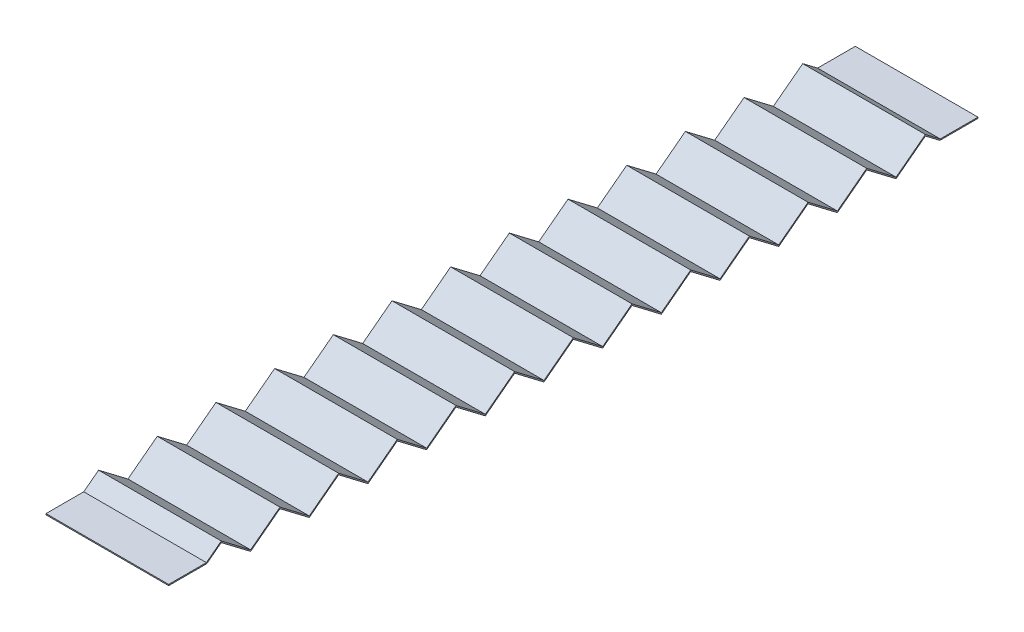
from build123d import *

# Parameters (mm, degrees)
EXTRUDE_THIN1_DEPTH = 27.5


with BuildPart() as part:
    # Sketch3 → Extrude-Thin1 (new, symmetric)
    with BuildSketch(Plane(origin=(0, 0, 0), x_dir=(0, 0, -1), z_dir=(1, 0, 0))):
        Polygon((0, 4.75), (17.084244345, 4.75), (23.576452135, 9.685950005), (36.729356406, -0.314049995), (49.882260677, 9.685950005), (63.035164948, -0.314049995), (76.188069219, 9.685950005), (89.34097349, -0.314049995), (102.493877761, 9.685950005), (115.646782031, -0.314049995), (128.799686302, 9.685950005), (141.952590573, -0.314049995), (155.105494844, 9.685950005), (168.258399115, -0.314049995), (181.411303386, 9.685950005), (194.564207657, -0.314049995), (207.717111927, 9.685950005), (220.870016198, -0.314049995), (234.022920469, 9.685950005), (247.17582474, -0.314049995), (260.328729011, 9.685950005), (273.481633282, -0.314049995), (286.634537553, 9.685950005), (299.787441823, -0.314049995), (312.940346094, 9.685950005), (326.093250365, -0.314049995), (339.246154636, 9.685950005), (345.738362426, 4.75), (362.822606771, 4.75), (362.822606771, 5.25), (345.906851117, 5.25), (339.246154636, 10.314049995), (326.093250365, 0.314049995), (312.940346094, 10.314049995), (299.787441823, 0.314049995), (286.634537553, 10.314049995), (273.481633282, 0.314049995), (260.328729011, 10.314049995), (247.17582474, 0.314049995), (234.022920469, 10.314049995), (220.870016198, 0.314049995), (207.717111927, 10.314049995), (194.564207657, 0.314049995), (181.411303386, 10.314049995), (168.258399115, 0.314049995), (155.105494844, 10.314049995), (141.952590573, 0.314049995), (128.799686302, 10.314049995), (115.646782031, 0.314049995), (102.493877761, 10.314049995), (89.34097349, 0.314049995), (76.188069219, 10.314049995), (63.035164948, 0.314049995), (49.882260677, 10.314049995), (36.729356406, 0.314049995), (23.576452135, 10.314049995), (16.915755655, 5.25), (0, 5.25), align=None)
    extrude(amount=EXTRUDE_THIN1_DEPTH, both=True)


solid = part.part
